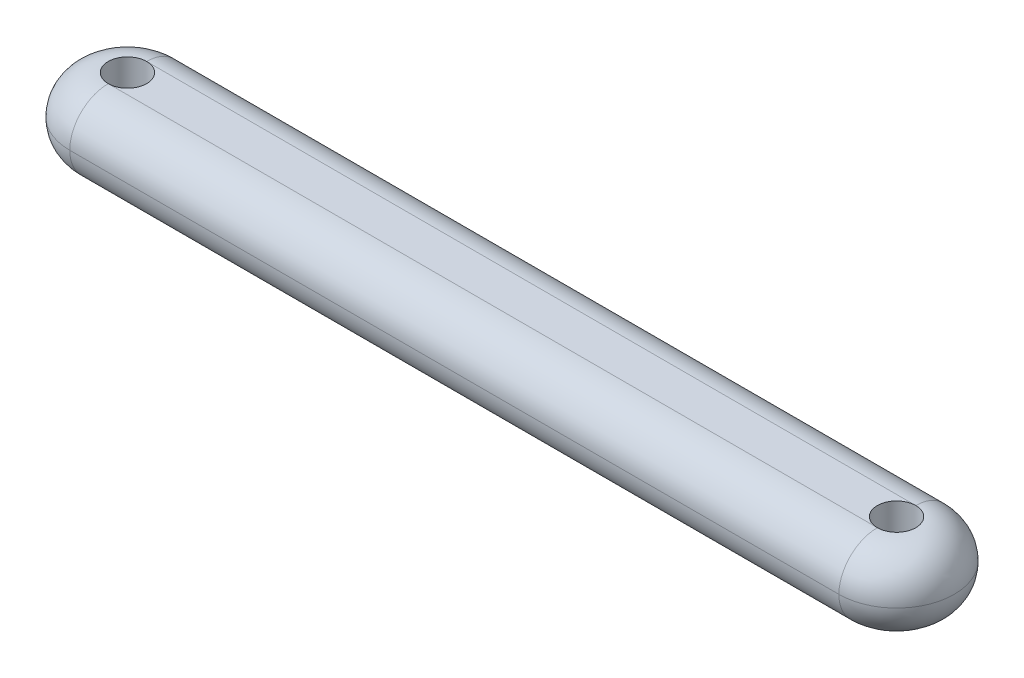
from build123d import *

# Parameters (mm, degrees)
CROQUIS1_R              = 2.5
SALIENTE_EXTRUIR1_DEPTH = 5
REDONDEO1_R             = 5


with BuildPart() as part:
    # Croquis1 → Saliente-Extruir1 (new, symmetric)
    with BuildSketch(Plane(origin=(0, 0, 0), x_dir=(-1, 0, 0), z_dir=(0, 1, 0))):
        with BuildLine():
            Line((0, 7.5), (100, 7.5))
            ThreePointArc((100, 7.5), (107.5, 0), (100, -7.5))
            Line((100, -7.5), (0, -7.5))
            ThreePointArc((0, -7.5), (-7.5, 0), (0, 7.5))
        make_face()
        with Locations(Location((0, 0, 0), (0, 0, 90))):
            Circle(CROQUIS1_R, mode=Mode.SUBTRACT)
        with Locations(Location((100, 0, 0), (0, 0, 90))):
            Circle(CROQUIS1_R, mode=Mode.SUBTRACT)
    extrude(amount=SALIENTE_EXTRUIR1_DEPTH, both=True)

    # Redondeo1
    redondeo1_edges = [part.edges().sort_by_distance(p)[0] for p in [
        (7.5, 5, 0),
        (-50, 5, 7.5),
        (-107.5, 5, 0),
        (7.5, -5, 0),
        (-50, -5, 7.5),
        (-107.5, -5, 0),
        (-50, 5, -7.5),
        (-50, -5, -7.5),
    ]]
    fillet(redondeo1_edges, radius=REDONDEO1_R - 0.0001)  # a hair under: the kernel refuses the full size


solid = part.part
